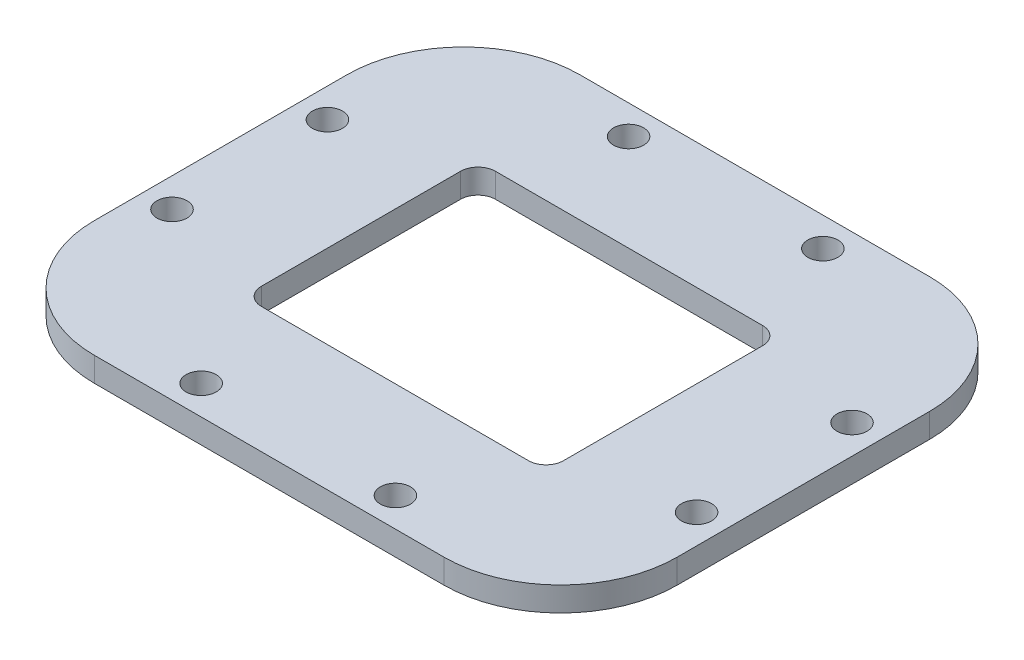
from build123d import *

# Parameters (mm, degrees)
SKETCH_1_W          = 60
SKETCH_1_H          = 50
SKETCH_1_W_2        = 29.5
SKETCH_1_H_2        = 22.5
EXTRUDE_1_DEPTH     = 2.5
SKETCH_8_R          = 1.55
CUT_EXTRUDE_2_DEPTH = 10
FILLET_1_R          = 1
FILLET_2_R          = 12
CUT_EXTRUDE_3_DEPTH = 10


with BuildPart() as part:
    # 草图1 → 凸台-拉伸1 (new body)
    with BuildSketch(Plane(origin=(0, 0, 0), x_dir=(1, 0, 0), z_dir=(0, 1, 0))):
        Rectangle(SKETCH_1_W, SKETCH_1_H)
        Rectangle(SKETCH_1_W_2, SKETCH_1_H_2, mode=Mode.SUBTRACT)
    extrude(amount=EXTRUDE_1_DEPTH)

    # 草图8 → 切除-拉伸2 (cut)
    with BuildSketch(Plane.XZ):
        with Locations((27, 8)):
            Circle(SKETCH_8_R)
        with Locations((10, 22)):
            Circle(SKETCH_8_R)
        with Locations((-10, 22)):
            Circle(SKETCH_8_R)
        with Locations((-27, 8)):
            Circle(SKETCH_8_R)
        with Locations((-27, -8)):
            Circle(SKETCH_8_R)
        with Locations((-10, -22)):
            Circle(SKETCH_8_R)
        with Locations((10, -22)):
            Circle(SKETCH_8_R)
        with Locations((27, -8)):
            Circle(SKETCH_8_R)
    extrude(amount=-CUT_EXTRUDE_2_DEPTH, mode=Mode.SUBTRACT)

    # 圆角1
    fillet_1_edges = [part.edges().sort_by_distance(p)[0] for p in [
        (-14.75, 1.25, 11.25),
        (14.75, 1.25, 11.25),
        (14.75, 1.25, -11.25),
        (-14.75, 1.25, -11.25),
    ]]
    fillet(fillet_1_edges, radius=FILLET_1_R)

    # 圆角2
    fillet_2_edges = [part.edges().sort_by_distance(p)[0] for p in [
        (30, 1.25, 25),
        (-30, 1.25, -25),
        (30, 1.25, -25),
        (-30, 1.25, 25),
    ]]
    fillet(fillet_2_edges, radius=FILLET_2_R)

    # 草图9 → 切除-拉伸3 (cut)
    with BuildSketch(Plane.XZ):
        with BuildLine():
            Line((-13.75, 12.05), (13.75, 12.05))
            ThreePointArc((13.75, 12.05), (15.022792206, 11.522792206), (15.55, 10.25))
            Line((15.55, 10.25), (15.55, -10.25))
            ThreePointArc((15.55, -10.25), (15.022792206, -11.522792206), (13.75, -12.05))
            Line((13.75, -12.05), (-13.75, -12.05))
            ThreePointArc((-13.75, -12.05), (-15.022792206, -11.522792206), (-15.55, -10.25))
            Line((-15.55, -10.25), (-15.55, 10.25))
            ThreePointArc((-15.55, 10.25), (-15.022792206, 11.522792206), (-13.75, 12.05))
        make_face()
    extrude(amount=-CUT_EXTRUDE_3_DEPTH, mode=Mode.SUBTRACT)


solid = part.part
